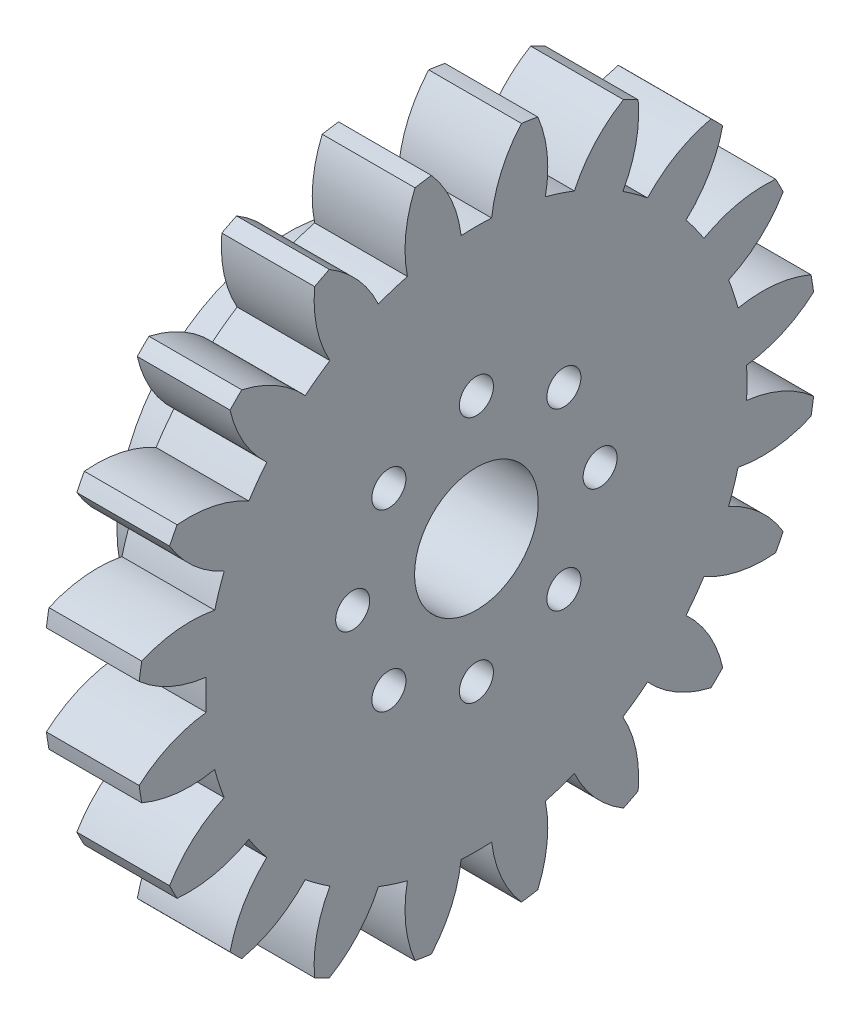
from build123d import *

# Parameters (mm, degrees)
BASPROSKE_W          = 6
BASPROSKE_H          = 22
TOOTHCUT_DEPTH       = 32.685959036
TEETHCUTS_COUNT      = 20
TEETHCUTS_ANGLE      = 342
HUBNEAONESKE_R       = 11
HUBNEARONE_DEPTH     = 6.2500508
BORSKE_R             = 4
BORE_DEPTH           = 12.2500508
M2_CLEARANCE_HOLE1_D = 2.2


with BuildPart() as part:
    # BasProSke → Base-Revolve (revolve)
    with BuildSketch(Plane(origin=(0, 0, 0), x_dir=(1, 0, 0), z_dir=(0, 1, 0))):
        with Locations((3, 11)):
            Rectangle(BASPROSKE_W, BASPROSKE_H)
    revolve(axis=Axis((-10, 0, 0), (1, 0, 0)))

    # TooCutSke → ToothCut (cut, through all)
    with BuildSketch(Plane(origin=(0, 0, 0), x_dir=(0, 0, -1), z_dir=(1, 0, 0))):
        with BuildLine():
            ThreePointArc((0.986171591, 17.471189616), (0, 17.499), (-0.986171591, 17.471189616))
            ThreePointArc((-0.986171591, 17.471189616), (-1.626916196, 19.798789858), (-2.932850173, 21.829260982))
            ThreePointArc((-2.932850173, 21.829260982), (0, 22.0254), (2.932850173, 21.829260982))
            ThreePointArc((2.932850173, 21.829260982), (1.626916196, 19.798789858), (0.986171591, 17.471189616))
        make_face()
    toothcut = extrude(amount=TOOTHCUT_DEPTH, mode=Mode.SUBTRACT)

    # TeethCuts: ToothCut ×20 about axis
    teethcuts_axis = Axis((-10, 0, 0), (1, 0, 0))
    for i in range(1, TEETHCUTS_COUNT):
        add(toothcut.rotate(teethcuts_axis, i * TEETHCUTS_ANGLE / (TEETHCUTS_COUNT - 1)), mode=Mode.SUBTRACT)

    # HubNeaOneSke → HubNearOne (add)
    with BuildSketch(Plane.ZY):
        Circle(HUBNEAONESKE_R)
    extrude(amount=HUBNEARONE_DEPTH)

    # BorSke → Bore (cut, symmetric)
    with BuildSketch(Plane(origin=(0, 0, 0), x_dir=(0, 0, -1), z_dir=(1, 0, 0))):
        Circle(BORSKE_R)
    extrude(amount=BORE_DEPTH, both=True, mode=Mode.SUBTRACT)

    # M2 Clearance Hole1 (through all)
    with Locations(Plane(origin=(6, 0, 0), x_dir=(0, 0, -1), z_dir=(1, 0, 0))):
        with Locations((0, 8), (5.656854249, 5.656854249), (8, 0), (5.656854249, -5.656854249), (0, -8), (-5.656854249, -5.656854249), (-8, 0), (-5.656854249, 5.656854249)):
            Hole(M2_CLEARANCE_HOLE1_D / 2)


solid = part.part
